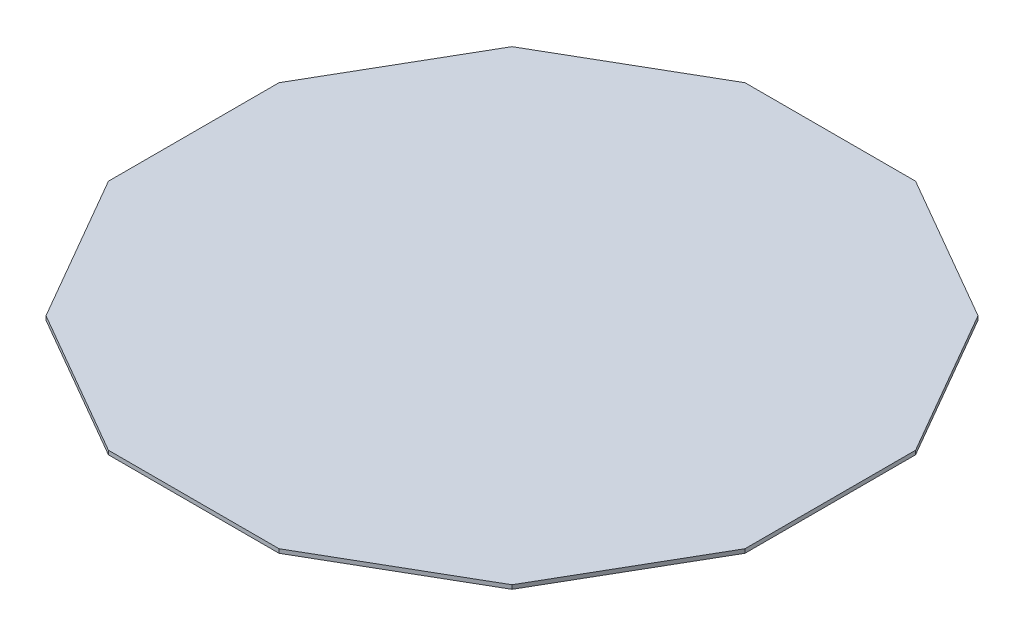
from build123d import *

# Parameters (mm, degrees)
EXTRUDE_1_DEPTH = 1


with BuildPart() as part:
    # ｽｹｯﾁ1 → ﾎﾞｽ - 押し出し1 (new body)
    with BuildSketch(Plane(origin=(0, 0, 0), x_dir=(1, 0, 0), z_dir=(0, 1, 0))):
        Polygon((-80, -21.435935394), (-58.564064606, -58.564064606), (-21.435935394, -80), (21.435935394, -80), (58.564064606, -58.564064606), (80, -21.435935394), (80, 21.435935394), (58.564064606, 58.564064606), (21.435935394, 80), (-21.435935394, 80), (-58.564064606, 58.564064606), (-80, 21.435935394), align=None)
    extrude(amount=EXTRUDE_1_DEPTH)


solid = part.part
